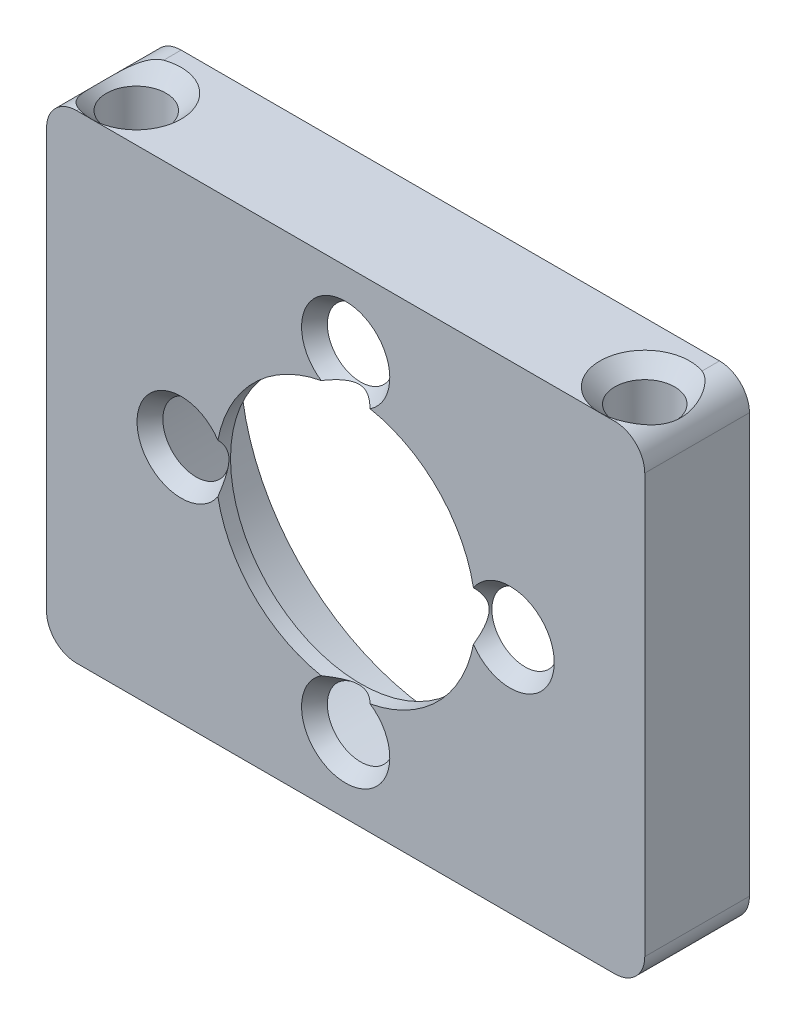
from build123d import *

# Parameters (mm, degrees)
SKETCH1_W               = 40
SKETCH1_H               = 32
BOSS_EXTRUDE1_DEPTH     = 7
SKETCH2_R               = 14.05
CUT_EXTRUDE1_DEPTH      = 6
SKETCH3_R               = 8.7
CUT_EXTRUDE2_DEPTH      = 6
SKETCH4_R               = 1.5
CUT_EXTRUDE3_DEPTH      = 6
CHAMFER1_SIZE           = 1.45
CHAMFER1_SIZE_2         = 1.995753785
CUT_EXTRUDE4_DEPTH      = 39.379682143
CUT_EXTRUDE4_DEPTH_BACK = 39.379682143
SKETCH5_R               = 2
FILLET1_R               = 2
CUT_EXTRUDE5_START      = -5
SKETCH6_R               = 2.375
CUT_EXTRUDE5_DEPTH      = 5
CHAMFER2_SIZE           = 1


with BuildPart() as part:
    # Sketch1 → Boss-Extrude1 (new body)
    with BuildSketch(Plane.XY):
        Rectangle(SKETCH1_W, SKETCH1_H)
    extrude(amount=BOSS_EXTRUDE1_DEPTH)

    # Sketch2 → Cut-Extrude1 (cut)
    with BuildSketch(Plane(origin=(0, 0, 0), x_dir=(-1, 0, 0), z_dir=(0, 0, -1))):
        Circle(SKETCH2_R)
    extrude(amount=-CUT_EXTRUDE1_DEPTH, mode=Mode.SUBTRACT)

    # Sketch3 → Cut-Extrude2 (cut)
    with BuildSketch(Plane(origin=(0, 0, 6), x_dir=(-1, 0, 0), z_dir=(0, 0, -1))):
        Circle(SKETCH3_R)
    extrude(amount=-CUT_EXTRUDE2_DEPTH, mode=Mode.SUBTRACT)

    # Sketch4 → Cut-Extrude3 (cut)
    with BuildSketch(Plane(origin=(0, 0, 6), x_dir=(-1, 0, 0), z_dir=(0, 0, -1))):
        with Locations((0, 11)):
            Circle(SKETCH4_R)
        with Locations((11, 0)):
            Circle(SKETCH4_R)
        with Locations((0, -11)):
            Circle(SKETCH4_R)
        with Locations((-11, 0)):
            Circle(SKETCH4_R)
    extrude(amount=-CUT_EXTRUDE3_DEPTH, mode=Mode.SUBTRACT)

    # Chamfer1
    # the kernel refuses this chamfer: 1.995753785, 1.45 mm, written as the material it takes off along each edge
    with BuildSketch(Plane(origin=(0, -11, 7), x_dir=(-1, 0, 0), z_dir=(0, -1, 0))) as chamfer1_piece_1:
        Polygon((1.5 + CHAMFER1_SIZE, 0), (1.5, CHAMFER1_SIZE_2), (1.5, 0), align=None)
    revolve(axis=Axis((0, -11, 7), (0, 0, -1)), mode=Mode.SUBTRACT)
    with BuildSketch(Plane(origin=(-11, 0, 7), x_dir=(-1, 0, 0), z_dir=(0, -1, 0))) as chamfer1_piece_2:
        Polygon((1.5 + CHAMFER1_SIZE, 0), (1.5, CHAMFER1_SIZE_2), (1.5, 0), align=None)
    revolve(axis=Axis((-11, 0, 7), (0, 0, -1)), mode=Mode.SUBTRACT)
    with BuildSketch(Plane(origin=(11, 0, 7), x_dir=(-1, 0, 0), z_dir=(0, -1, 0))) as chamfer1_piece_3:
        Polygon((1.5 + CHAMFER1_SIZE, 0), (1.5, CHAMFER1_SIZE_2), (1.5, 0), align=None)
    revolve(axis=Axis((11, 0, 7), (0, 0, -1)), mode=Mode.SUBTRACT)
    with BuildSketch(Plane(origin=(0, 11, 7), x_dir=(-1, 0, 0), z_dir=(0, -1, 0))) as chamfer1_piece_4:
        Polygon((1.5 + CHAMFER1_SIZE, 0), (1.5, CHAMFER1_SIZE_2), (1.5, 0), align=None)
    revolve(axis=Axis((0, 11, 7), (0, 0, -1)), mode=Mode.SUBTRACT)

    # Sketch5 → Cut-Extrude4 (cut, two sides: drawn at the far end of the back side and taken through both)
    with BuildSketch(Plane(origin=(0, 16, 0), x_dir=(1, 0, 0), z_dir=(0, 1, 0)).offset(-CUT_EXTRUDE4_DEPTH_BACK)):
        with Locations(Location((-17, -4, 0), (0, 0, 270))):
            Circle(SKETCH5_R)
        with Locations(Location((17, -4, 0), (0, 0, 270))):
            Circle(SKETCH5_R)
    extrude(amount=CUT_EXTRUDE4_DEPTH + CUT_EXTRUDE4_DEPTH_BACK, mode=Mode.SUBTRACT)

    # Fillet1
    # the kernel refuses this fillet: 2 mm, written as the material it takes off along each edge
    with BuildSketch(Plane(origin=(20, -16, -5), x_dir=(0, 1, 0), z_dir=(0, 0, 1)), Plane(origin=(20, 16, -5), x_dir=(-1, 0, 0), z_dir=(0, 0, 1))) as fillet1_piece_1:
        with BuildLine():
            CenterArc((FILLET1_R, FILLET1_R), FILLET1_R, 180, 90)
            Line((0, FILLET1_R), (0, 0))
            Line((0, 0), (FILLET1_R, 0))
        make_face()
    extrude(amount=17, mode=Mode.SUBTRACT)
    with BuildSketch(Plane(origin=(-20, -16, -5), x_dir=(0, 1, 0), z_dir=(0, 0, 1)), Plane(origin=(-20, 16, -5), x_dir=(1, 0, 0), z_dir=(0, 0, 1))) as fillet1_piece_2:
        with BuildLine():
            CenterArc((FILLET1_R, -FILLET1_R), FILLET1_R, 90, 90)
            Line((0, -FILLET1_R), (0, 0))
            Line((0, 0), (FILLET1_R, 0))
        make_face()
    extrude(amount=17, mode=Mode.SUBTRACT)

    # Sketch6 → Cut-Extrude5 (cut)
    with BuildSketch(Plane(origin=(0, 16, 0), x_dir=(1, 0, 0), z_dir=(0, 1, 0)).offset(CUT_EXTRUDE5_START)):
        with Locations(Location((-17, -4, 0), (0, 0, 270))):
            Circle(SKETCH6_R)
        with Locations(Location((17, -4, 0), (0, 0, 270))):
            Circle(SKETCH6_R)
    cut_extrude5 = extrude(amount=-CUT_EXTRUDE5_DEPTH, mode=Mode.SUBTRACT)

    # Mirror1: Cut-Extrude5 across plane
    add(cut_extrude5.mirror(Plane.ZX), mode=Mode.SUBTRACT)

    # Chamfer2
    # the kernel refuses this chamfer: 1 mm, written as the material it takes off along each edge
    with BuildSketch(Plane(origin=(17, -16, 4), x_dir=(0.006283143965557505, 0, 0.9999802608561372), z_dir=(-0.9999802608561372, 0, 0.006283143965557505))) as chamfer2_piece_1:
        Polygon((2 + CHAMFER2_SIZE, 0), (2, CHAMFER2_SIZE), (2, 0), align=None)
    revolve(axis=Axis((17, -16, 4), (0, 1, 0)), revolution_arc=359.64, mode=Mode.SUBTRACT)
    with BuildSketch(Plane(origin=(-17, -16, 4), x_dir=(0, 0, 1), z_dir=(-1, 0, 0))) as chamfer2_piece_2:
        Polygon((2 + CHAMFER2_SIZE, 0), (2, CHAMFER2_SIZE), (2, 0), align=None)
    revolve(axis=Axis((-17, -16, 4), (0, 1, 0)), revolution_arc=359.64, mode=Mode.SUBTRACT)
    with BuildSketch(Plane(origin=(-17, 16, 4), x_dir=(0, 0, 1), z_dir=(-1, 0, 0))) as chamfer2_piece_3:
        Polygon((2 + CHAMFER2_SIZE, 0), (2, -CHAMFER2_SIZE), (2, 0), align=None)
    revolve(axis=Axis((-17, 16, 4), (0, 1, 0)), revolution_arc=359.64, mode=Mode.SUBTRACT)
    with BuildSketch(Plane(origin=(17, 16, 4), x_dir=(0.006283143965557505, 0, 0.9999802608561372), z_dir=(-0.9999802608561372, 0, 0.006283143965557505))) as chamfer2_piece_4:
        Polygon((2 + CHAMFER2_SIZE, 0), (2, -CHAMFER2_SIZE), (2, 0), align=None)
    revolve(axis=Axis((17, 16, 4), (0, 1, 0)), revolution_arc=359.64, mode=Mode.SUBTRACT)
    with BuildSketch(Plane(origin=(17, 16, 4), x_dir=(0, 0, 1), z_dir=(-1, 0, 0))) as chamfer2_piece_5:
        Polygon((2 + CHAMFER2_SIZE, 0), (2, -CHAMFER2_SIZE), (2, 0), align=None)
    revolve(axis=Axis((17, 16, 4), (0, 1, 0)), revolution_arc=251.029734773, mode=Mode.SUBTRACT)
    with BuildSketch(Plane(origin=(-17, 16, 4), x_dir=(0.9456874082674533, 0, -0.3250774151558165), z_dir=(0.3250774151558165, 0, 0.9456874082674533))) as chamfer2_piece_6:
        Polygon((2 + CHAMFER2_SIZE, 0), (2, -CHAMFER2_SIZE), (2, 0), align=None)
    revolve(axis=Axis((-17, 16, 4), (0, 1, 0)), revolution_arc=251.029734773, mode=Mode.SUBTRACT)
    with BuildSketch(Plane(origin=(-17, -16, 4), x_dir=(0.9456874082674562, 0, -0.3250774151558082), z_dir=(0.3250774151558082, 0, 0.9456874082674562))) as chamfer2_piece_7:
        Polygon((2 + CHAMFER2_SIZE, 0), (2, CHAMFER2_SIZE), (2, 0), align=None)
    revolve(axis=Axis((-17, -16, 4), (0, 1, 0)), revolution_arc=251.029734773, mode=Mode.SUBTRACT)
    with BuildSketch(Plane(origin=(17, -16, 4), x_dir=(0, 0, 1), z_dir=(-1, 0, 0))) as chamfer2_piece_8:
        Polygon((2 + CHAMFER2_SIZE, 0), (2, CHAMFER2_SIZE), (2, 0), align=None)
    revolve(axis=Axis((17, -16, 4), (0, 1, 0)), revolution_arc=251.029734773, mode=Mode.SUBTRACT)


solid = part.part
